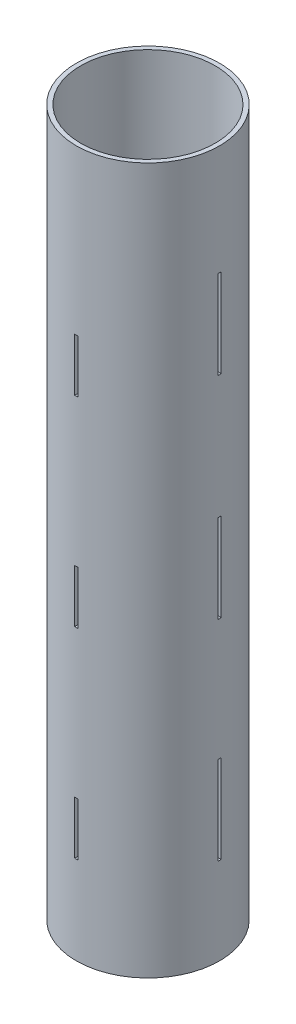
from build123d import *

# Parameters (mm, degrees)
SKETCH1_R           = 32.5
SKETCH1_R_2         = 30.5
BOSS_EXTRUDE1_DEPTH = 320.25
SKETCH2_W           = 1.5
SKETCH2_H           = 40
CUT_EXTRUDE1_DEPTH  = 50
SKETCH3_W           = 1.5
SKETCH3_H           = 24
CUT_EXTRUDE2_DEPTH  = 50


with BuildPart() as part:
    # Sketch1 → Boss-Extrude1 (new body)
    with BuildSketch(Plane(origin=(0, 0, 0), x_dir=(1, 0, 0), z_dir=(0, 1, 0))):
        Circle(SKETCH1_R)
        Circle(SKETCH1_R_2, mode=Mode.SUBTRACT)
    extrude(amount=BOSS_EXTRUDE1_DEPTH)

    # Sketch2 → Cut-Extrude1 (cut, symmetric)
    with BuildSketch(Plane(origin=(0, 0, 0), x_dir=(0, 0, -1), z_dir=(1, 0, 0))):
        with Locations((0, 250.379808483)):
            Rectangle(SKETCH2_W, SKETCH2_H)
        with Locations((0, 154.5)):
            Rectangle(SKETCH2_W, SKETCH2_H)
        with Locations((0, 59.5)):
            Rectangle(SKETCH2_W, SKETCH2_H)
    extrude(amount=CUT_EXTRUDE1_DEPTH, both=True, mode=Mode.SUBTRACT)

    # Sketch3 → Cut-Extrude2 (cut, symmetric)
    with BuildSketch(Plane.XY):
        with Locations((0, 233.879808483)):
            Rectangle(SKETCH3_W, SKETCH3_H)
        with Locations((0, 143)):
            Rectangle(SKETCH3_W, SKETCH3_H)
        with Locations((0, 52)):
            Rectangle(SKETCH3_W, SKETCH3_H)
    extrude(amount=CUT_EXTRUDE2_DEPTH, both=True, mode=Mode.SUBTRACT)


solid = part.part
